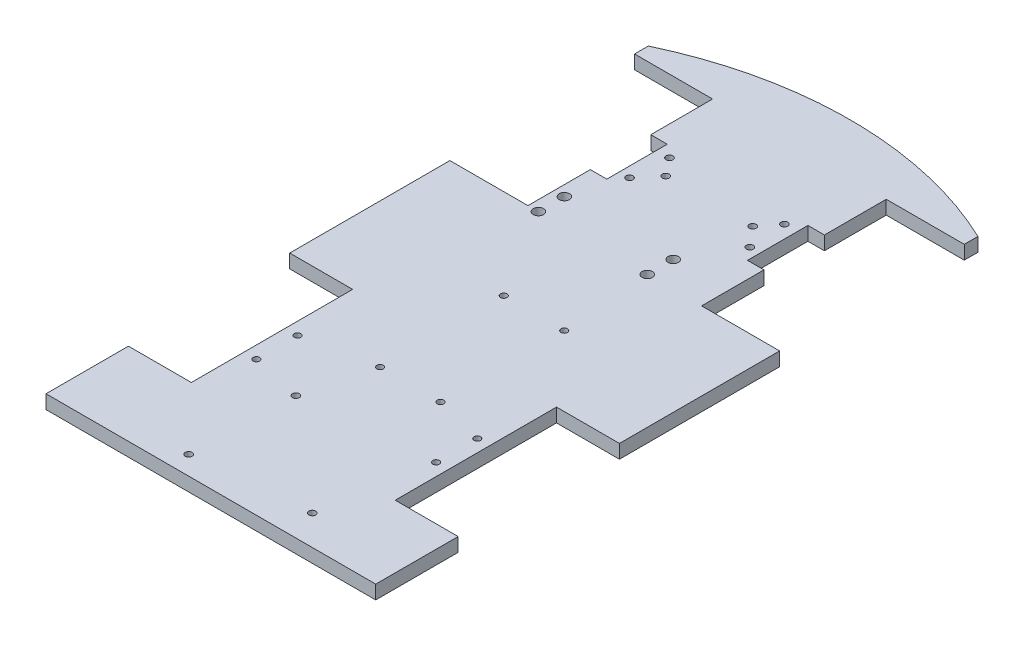
from build123d import *

# Parameters (mm, degrees)
CHASSIS_DEPTH      = 6.35
SKETCH2_R          = 1.5875
SKETCH2_R_2        = 2.38125
SKETCH2_R_3        = 1.5
CUT_EXTRUDE1_DEPTH = 17.78


with BuildPart() as part:
    # Sketch1 → Chassis (new body)
    with BuildSketch(Plane(origin=(0, 0, 0), x_dir=(1, 0, 0), z_dir=(0, 1, 0))):
        with BuildLine():
            ThreePointArc((76.2, 49.022), (39.053241005, 61.832834411), (0, 66.173750115))
            Line((0, 66.173750115), (0, -229.362))
            Line((0, -229.362), (76.2, -229.362))
            Line((76.2, -229.362), (76.2, -191.262))
            Line((76.2, -191.262), (47.117, -191.262))
            Line((47.117, -191.262), (47.117, -116.713))
            Line((47.117, -116.713), (76.2, -116.713))
            Line((76.2, -116.713), (76.2, -42.672))
            Line((76.2, -42.672), (40.132, -42.672))
            Line((40.132, -42.672), (40.132, -13.843))
            Line((40.132, -13.843), (32.512, -13.843))
            Line((32.512, -13.843), (32.512, 14.097))
            Line((32.512, 14.097), (40.132, 14.097))
            Line((40.132, 14.097), (40.132, 42.672))
            Line((40.132, 42.672), (76.2, 42.672))
            Line((76.2, 42.672), (76.2, 49.022))
        make_face()
    chassis = extrude(amount=CHASSIS_DEPTH)

    # Mirror1: Chassis across plane
    add(chassis.mirror(Plane(origin=(0, 6.35, 0), x_dir=(0, 0, 1), z_dir=(1, 0, 0))))

    # Sketch2 → Cut-Extrude1 (cut)
    with BuildSketch(Plane(origin=(0, 0, 0), x_dir=(1, 0, 0), z_dir=(0, 1, 0))):
        with Locations((-17.703140953, -172.359887538)):
            Circle(SKETCH2_R)
        with Locations((-18.973140953, -220.619887538)):
            Circle(SKETCH2_R)
        with Locations((33.096859047, -215.539887538)):
            Circle(SKETCH2_R)
        with Locations((-26.555704526, 9.169971692)):
            Circle(SKETCH2_R)
        with Locations((-20.105647723, 0.999384842)):
            Circle(SKETCH2_R)
        with Locations((-27.786476371, -8.040568412)):
            Circle(SKETCH2_R)
        with Locations((26.555704526, 9.169971692)):
            Circle(SKETCH2_R)
        with Locations((20.105647723, 0.999384842)):
            Circle(SKETCH2_R)
        with Locations((27.786476371, -8.040568412)):
            Circle(SKETCH2_R)
        with Locations((15, -30.652833299)):
            Circle(SKETCH2_R_2)
        with Locations((15, -42.652833299)):
            Circle(SKETCH2_R_2)
        with Locations((-35.3, -30.652833299)):
            Circle(SKETCH2_R_2)
        with Locations((-35.3, -42.652833299)):
            Circle(SKETCH2_R_2)
        with Locations((18.288, -84.328)):
            Circle(SKETCH2_R_3)
        with Locations((-9.652, -84.328)):
            Circle(SKETCH2_R_3)
        with Locations((18.288, -141.478)):
            Circle(SKETCH2_R_3)
        with Locations((-9.652, -141.478)):
            Circle(SKETCH2_R_3)
        with Locations((-41.402, -147.875000023)):
            Circle(SKETCH2_R_3)
        with Locations((-41.402, -166.925000023)):
            Circle(SKETCH2_R_3)
        with Locations((41.402, -147.605334461)):
            Circle(SKETCH2_R_3)
        with Locations((41.402, -166.655334461)):
            Circle(SKETCH2_R_3)
    extrude(amount=CUT_EXTRUDE1_DEPTH, mode=Mode.SUBTRACT)


solid = part.part
